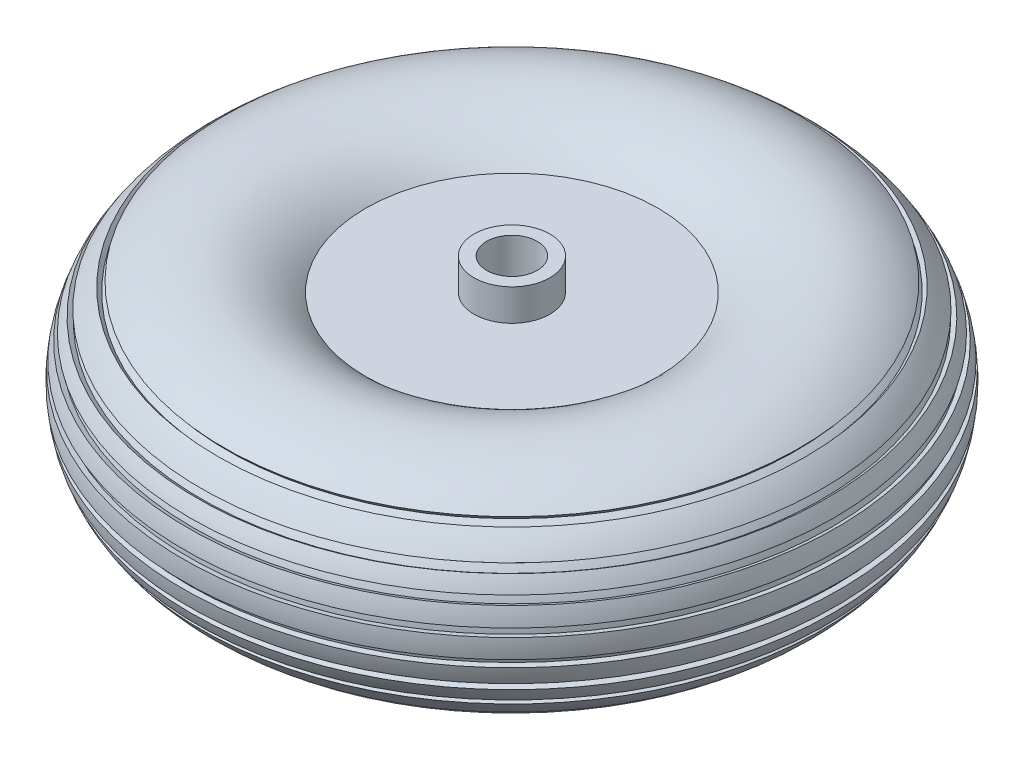
from build123d import *
from build123d.topology import SkipClean

# Parameters (mm, degrees)
SKETCH3_R           = 15
SKETCH3_R_2         = 10
BOSS_EXTRUDE1_DEPTH = 12.5
BOSS_EXTRUDE2_START = 12.5
SKETCH4_R           = 15
SKETCH4_R_2         = 10
BOSS_EXTRUDE2_DEPTH = 12.5


with BuildPart() as part:
    # Sketch2 → Revolve1 (revolve)
    with BuildSketch(Plane.YZ):
        with BuildLine():
            ThreePointArc((-3.467976742, 62.934142485), (-4.969540598, 62.776480794), (-6.464166241, 62.562832929))
            Line((-6.464166241, 62.562832929), (-6.798959627, 64.628658844))
            ThreePointArc((-6.798959627, 64.628658844), (-10.127953169, 63.951609959), (-13.392236629, 63.010840756))
            Line((-13.392236629, 63.010840756), (-12.59221219, 61.071065144))
            ThreePointArc((-12.59221219, 61.071065144), (-14.008930253, 60.577117286), (-15.406334109, 60.030914924))
            Line((-15.406334109, 60.030914924), (-16.204262036, 61.965607237))
            ThreePointArc((-16.204262036, 61.965607237), (-18.972648423, 60.706118507), (-21.643870953, 59.251867758))
            Line((-21.643870953, 59.251867758), (-20.480648561, 57.508280256))
            ThreePointArc((-20.480648561, 57.508280256), (-21.744958163, 56.733326396), (-22.979980946, 55.912503041))
            Line((-22.979980946, 55.912503041), (-24.170164699, 57.633893745))
            ThreePointArc((-24.170164699, 57.633893745), (-28.149638346, 54.516994817), (-31.730906322, 50.949672415))
            Line((-31.730906322, 50.949672415), (-30.168417624, 49.557425171))
            ThreePointArc((-30.168417624, 49.557425171), (-31.121960381, 48.447456792), (-32.034688012, 47.303690268))
            Line((-32.034688012, 47.303690268), (-33.64639754, 48.64079966))
            ThreePointArc((-33.64639754, 48.64079966), (-42.41040785, 19.917882603), (-30, -7.427969331))
            Line((-30, -7.427969331), (-30, -51.79482847))
            Line((-30, -51.79482847), (-30, -55.176017116))
            Line((-30, -55.176017116), (30, -55.176017116))
            Line((30, -55.176017116), (30, -51.79482847))
            Line((30, -51.79482847), (30, -20.176017116))
            Line((30, -20.176017116), (30, -7.427969331))
            ThreePointArc((30, -7.427969331), (42.41040785, 19.917882603), (33.64639754, 48.64079966))
            Line((33.64639754, 48.64079966), (32.034688012, 47.303690268))
            ThreePointArc((32.034688012, 47.303690268), (31.121960381, 48.447456792), (30.168417624, 49.557425171))
            Line((30.168417624, 49.557425171), (31.730906322, 50.949672415))
            ThreePointArc((31.730906322, 50.949672415), (28.149638346, 54.516994817), (24.170164699, 57.633893745))
            Line((24.170164699, 57.633893745), (22.979980946, 55.912503041))
            ThreePointArc((22.979980946, 55.912503041), (21.744958163, 56.733326396), (20.480648561, 57.508280256))
            Line((20.480648561, 57.508280256), (21.643870953, 59.251867758))
            ThreePointArc((21.643870953, 59.251867758), (18.972648423, 60.706118507), (16.204262036, 61.965607237))
            Line((16.204262036, 61.965607237), (15.406334109, 60.030914924))
            ThreePointArc((15.406334109, 60.030914924), (14.008930253, 60.577117286), (12.59221219, 61.071065144))
            Line((12.59221219, 61.071065144), (13.392236629, 63.010840756))
            ThreePointArc((13.392236629, 63.010840756), (10.127953169, 63.951609959), (6.798959627, 64.628658844))
            Line((6.798959627, 64.628658844), (6.464166241, 62.562832929))
            ThreePointArc((6.464166241, 62.562832929), (4.969540598, 62.776480794), (3.467976742, 62.934142485))
            Line((3.467976742, 62.934142485), (3.798959627, 65.005887252))
            ThreePointArc((3.798959627, 65.005887252), (0, 65.176017116), (-3.798959627, 65.005887252))
            Line((-3.798959627, 65.005887252), (-3.467976742, 62.934142485))
        make_face()
    revolve(axis=Axis((0, -30, -65.176017116), (0, 1, 0)))

    # Sketch3 → Boss-Extrude1 (add)
    with SkipClean():  # the faces are left unmerged after this step: merging them gives an invalid solid
        with BuildSketch(Plane.XZ.offset(30)):
            with Locations((0, -65.176017116)):
                Circle(SKETCH3_R)
            with Locations((0, -65.176017116)):
                Circle(SKETCH3_R_2, mode=Mode.SUBTRACT)
        extrude(amount=BOSS_EXTRUDE1_DEPTH)

    # Sketch4 → Boss-Extrude2 (add)
    with SkipClean():  # the faces are left unmerged after this step: merging them gives an invalid solid
        with BuildSketch(Plane(origin=(0, 30, 0), x_dir=(-1, 0, 0), z_dir=(0, 1, 0)).offset(BOSS_EXTRUDE2_START)):
            with Locations((0, -65.176017116)):
                Circle(SKETCH4_R)
            with Locations((0, -65.176017116)):
                Circle(SKETCH4_R_2, mode=Mode.SUBTRACT)
        extrude(amount=-BOSS_EXTRUDE2_DEPTH)


solid = part.part
